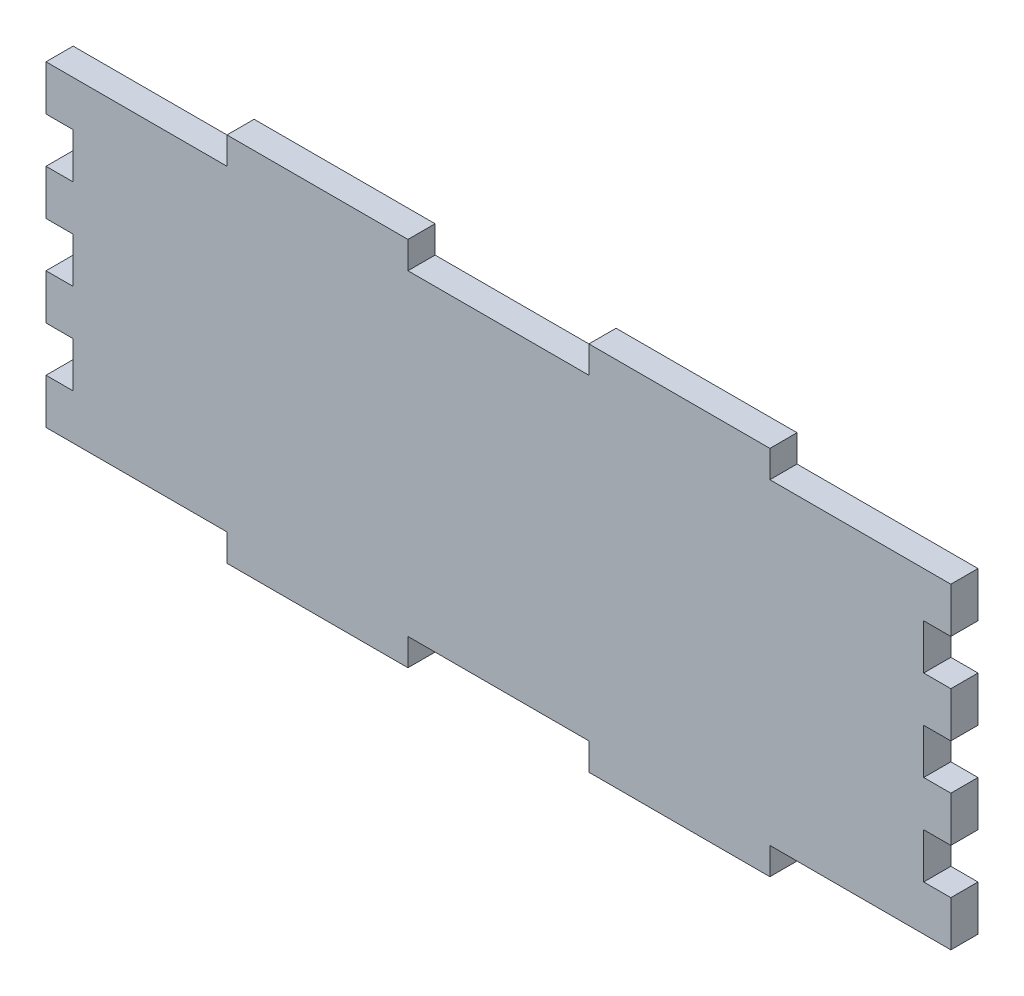
from build123d import *

# Parameters (mm, degrees)
SKETCH1_W           = 200
SKETCH1_H           = 82
BOSS_EXTRUDE1_DEPTH = 6
SKETCH2_W           = 40
SKETCH2_H           = 6
CUT_EXTRUDE1_DEPTH  = 6
SKETCH3_W           = 6
SKETCH3_H           = 10
CUT_EXTRUDE2_DEPTH  = 10


with BuildPart() as part:
    # Sketch1 → Boss-Extrude1 (new body)
    with BuildSketch(Plane.XY):
        Rectangle(SKETCH1_W, SKETCH1_H)
    extrude(amount=BOSS_EXTRUDE1_DEPTH)

    # Sketch2 → Cut-Extrude1 (cut)
    with BuildSketch(Plane.XY.offset(6)):
        with Locations((0, -38)):
            Rectangle(SKETCH2_W, SKETCH2_H)
        with Locations((-80, -38)):
            Rectangle(SKETCH2_W, SKETCH2_H)
        with Locations((80, -38)):
            Rectangle(SKETCH2_W, SKETCH2_H)
    cut_extrude1 = extrude(amount=-CUT_EXTRUDE1_DEPTH, mode=Mode.SUBTRACT)

    # Sketch3 → Cut-Extrude2 (cut)
    with BuildSketch(Plane.XY.offset(6)):
        with Locations((-97, -20)):
            Rectangle(SKETCH3_W, SKETCH3_H)
        with Locations((-97, 0)):
            Rectangle(SKETCH3_W, SKETCH3_H)
        with Locations((-97, 20)):
            Rectangle(SKETCH3_W, SKETCH3_H)
    cut_extrude2 = extrude(amount=-CUT_EXTRUDE2_DEPTH, mode=Mode.SUBTRACT)

    # Mirror1: Cut-Extrude2 across plane
    add(cut_extrude2.mirror(Plane(origin=(0, 0, 0), x_dir=(0, 0, 1), z_dir=(1, 0, 0))), mode=Mode.SUBTRACT)

    # Mirror2: Cut-Extrude1 across plane
    add(cut_extrude1.mirror(Plane.ZX), mode=Mode.SUBTRACT)


solid = part.part
